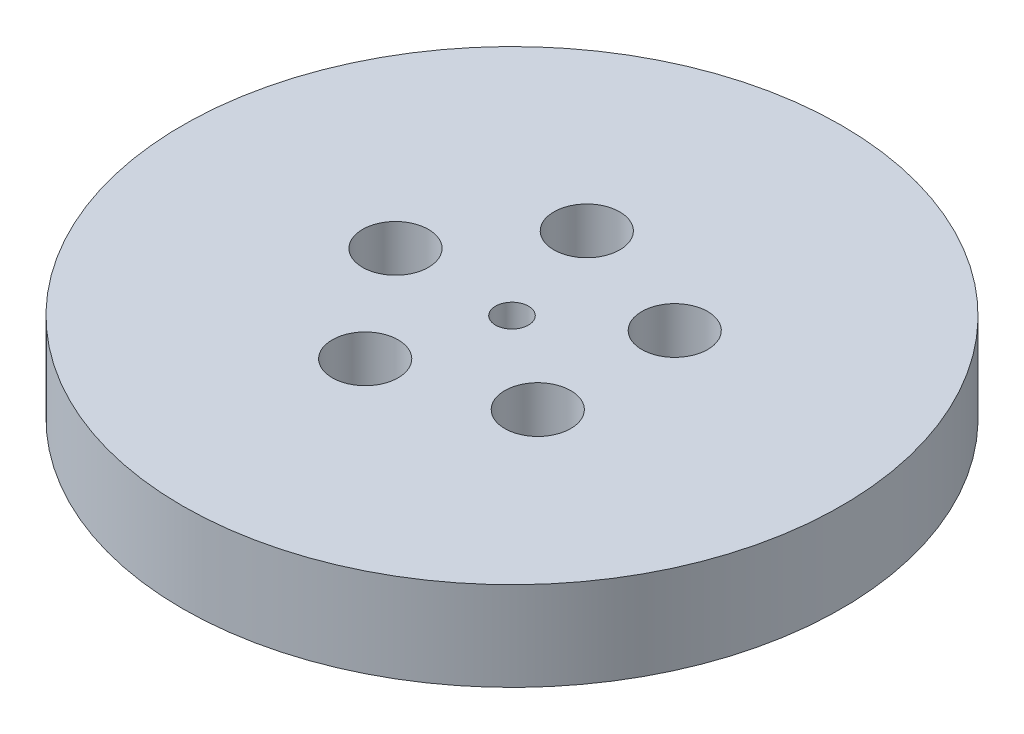
from build123d import *

# Parameters (mm, degrees)
SKETCH1_R           = 100
BOSS_EXTRUDE1_DEPTH = 27
SKETCH2_R           = 5
CUT_EXTRUDE1_DEPTH  = 144.975692393
SKETCH3_R           = 10
CUT_EXTRUDE2_DEPTH  = 22.800327297
CIRPATTERN1_COUNT   = 5


with BuildPart() as part:
    # Sketch1 → Boss-Extrude1 (new body)
    with BuildSketch(Plane(origin=(0, 0, 0), x_dir=(1, 0, 0), z_dir=(0, 1, 0))):
        Circle(SKETCH1_R)
    extrude(amount=BOSS_EXTRUDE1_DEPTH)

    # Sketch2 → Cut-Extrude1 (cut, through all)
    with BuildSketch(Plane(origin=(0, 0, 0), x_dir=(1, 0, 0), z_dir=(0, 1, 0))):
        Circle(SKETCH2_R)
    extrude(amount=CUT_EXTRUDE1_DEPTH, mode=Mode.SUBTRACT)

    # Sketch3 → Cut-Extrude2 (cut)
    with BuildSketch(Plane(origin=(0, 27, 0), x_dir=(1, 0, 0), z_dir=(0, 1, 0))):
        with Locations((-35.35113458, 0)):
            Circle(SKETCH3_R)
    cut_extrude2 = extrude(amount=-CUT_EXTRUDE2_DEPTH, mode=Mode.SUBTRACT)

    # CirPattern1: Cut-Extrude2 ×5 about axis
    cirpattern1_axis = Axis((0, 0, 0), (0, 1, 0))
    for i in range(1, CIRPATTERN1_COUNT):
        add(cut_extrude2.rotate(cirpattern1_axis, i * 360 / CIRPATTERN1_COUNT), mode=Mode.SUBTRACT)


solid = part.part
